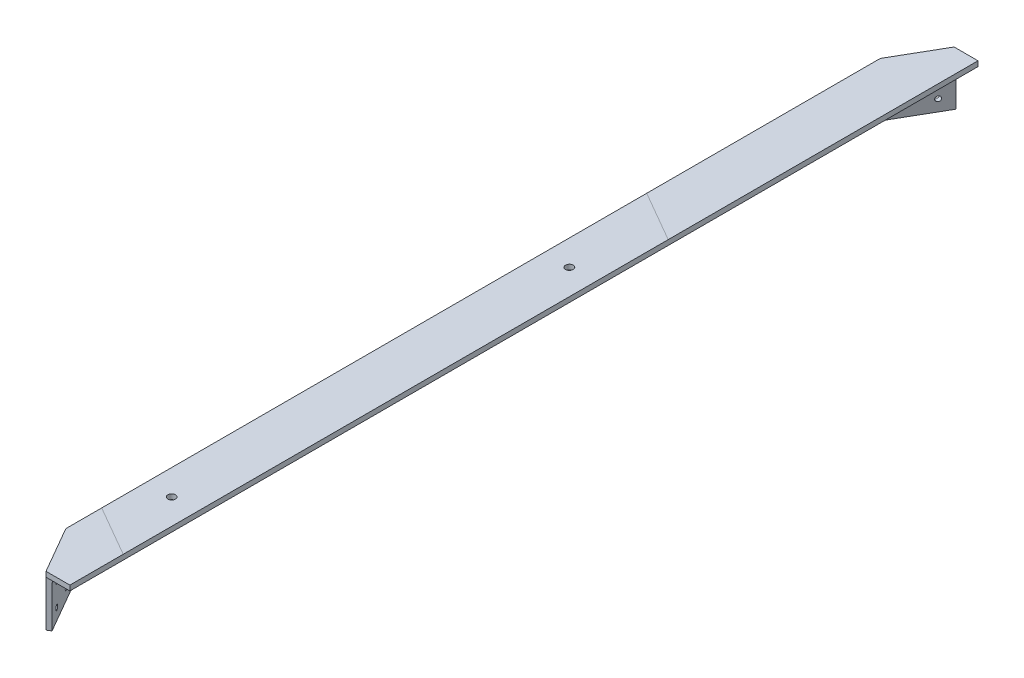
from build123d import *

# Parameters (mm, degrees)
BOSS_EXTRUDE1_DEPTH  = 640
BOSS_EXTRUDE2_DEPTH  = 8
BOSS_EXTRUDE3_DEPTH  = 72
SKETCH6_R            = 4
CUT_EXTRUDE1_DEPTH   = 8
FILLET1_R            = 10
FILLET2_R            = 8
FILLET1_OF_MIRROR1_R = 10
FILLET2_OF_MIRROR1_R = 8
SKETCH8_R            = 6
CUT_EXTRUDE2_DEPTH   = 8


with BuildPart() as part:
    # Sketch1 → Boss-Extrude1 (new body)
    with BuildSketch(Plane.XY):
        Polygon((-8, 8), (72, 8), (72, 0), (0, 0), (0, -72), (-8, -72), align=None)
    boss_extrude1 = extrude(amount=BOSS_EXTRUDE1_DEPTH)

    # Sketch3 → Boss-Extrude2 (add)
    with BuildSketch(Plane(origin=(0, 0, 0), x_dir=(1, 0, 0), z_dir=(0, 1, 0))):
        Polygon((-8, -640), (34.5, -713.612159322), (72, -713.612159322), (72, -640), align=None)
    boss_extrude2 = extrude(amount=BOSS_EXTRUDE2_DEPTH)

    # Sketch4 → Boss-Extrude3 (add)
    with BuildSketch(Plane.XZ):
        Polygon((-8, 640), (34.5, 713.612159322), (40.5, 710.148057707), (0, 640), align=None)
    boss_extrude3 = extrude(amount=BOSS_EXTRUDE3_DEPTH)

    # Sketch6 → Cut-Extrude1 (cut)
    with BuildSketch(Plane(origin=(-277.128129211, 0, 160), x_dir=(-0.4999999999999956, 0, -0.8660254037844413), z_dir=(0.8660254037844413, 0, -0.4999999999999956))):
        with Locations((-615.006258422, -18)):
            Circle(SKETCH6_R)
        with Locations((-574.506258422, -18)):
            Circle(SKETCH6_R)
        with Locations((-574.506258422, -54)):
            Circle(SKETCH6_R)
        with Locations((-615.006258422, -54)):
            Circle(SKETCH6_R)
    cut_extrude1 = extrude(amount=-CUT_EXTRUDE1_DEPTH, mode=Mode.SUBTRACT)

    # Fillet1
    fillet1_edges = [part.edges().sort_by_distance(p)[0] for p in [
        (-8, -32, 640),
        (0, -36, 640),
    ]]
    fillet(fillet1_edges, radius=FILLET1_R)

    # Fillet2
    fillet2_edges = [part.edges().sort_by_distance(p)[0] for p in [
        (0, 0, 318.660254038),
        (0.340741737, 0, 639.908698527),
        (20.919872981, 0, 676.234282891),
    ]]
    fillet(fillet2_edges, radius=FILLET2_R)

    # Mirror1: Boss-Extrude1, Boss-Extrude2, Boss-Extrude3, Cut-Extrude1 across plane
    add(boss_extrude1.mirror(Plane.XY))
    add(boss_extrude2.mirror(Plane.XY))
    add(boss_extrude3.mirror(Plane.XY))
    add(cut_extrude1.mirror(Plane.XY), mode=Mode.SUBTRACT)

    # Fillet1 of Mirror1
    fillet1_of_mirror1_edges = [part.edges().sort_by_distance(p)[0] for p in [
        (-8, -32, -640),
        (0, -36, -640),
    ]]
    fillet(fillet1_of_mirror1_edges, radius=FILLET1_OF_MIRROR1_R)

    # Fillet2 of Mirror1
    fillet2_of_mirror1_edges = [part.edges().sort_by_distance(p)[0] for p in [
        (0, 0, -318.660254038),
        (0.340741737, 0, -639.908698527),
        (20.919872981, 0, -676.234282891),
    ]]
    fillet(fillet2_of_mirror1_edges, radius=FILLET2_OF_MIRROR1_R)

    # Sketch8 → Cut-Extrude2 (cut)
    with BuildSketch(Plane(origin=(0, 8, 0), x_dir=(1, 0, 0), z_dir=(0, 1, 0))):
        with Locations((32, 111.387840678)):
            Circle(SKETCH8_R)
        with Locations((32, -513.612159322)):
            Circle(SKETCH8_R)
    extrude(amount=-CUT_EXTRUDE2_DEPTH, mode=Mode.SUBTRACT)


solid = part.part
